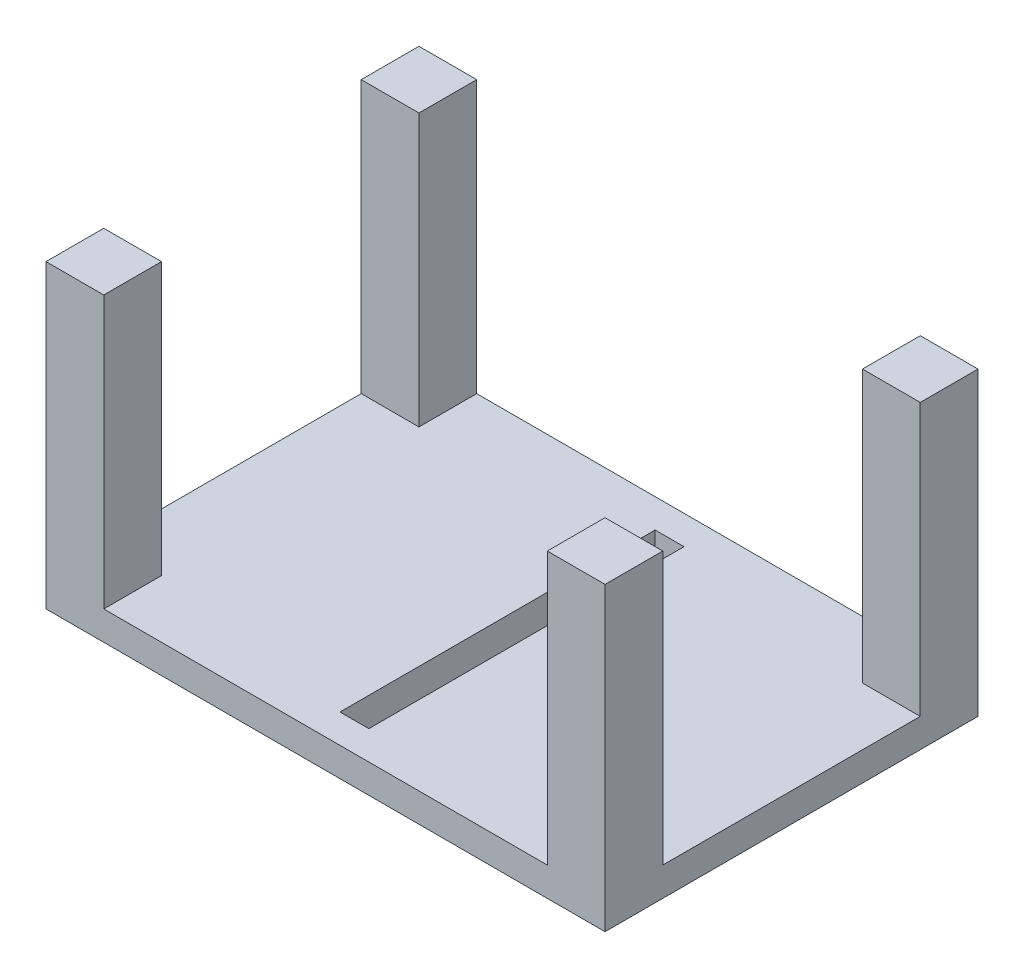
from build123d import *

# Parameters (mm, degrees)
SKETCH1_W           = 122.936
SKETCH1_H           = 82.0166
BOSS_EXTRUDE3_DEPTH = 6.35
SKETCH2_W           = 12.7
SKETCH2_H           = 12.7
BOSS_EXTRUDE4_DEPTH = 59.8
CUT_EXTRUDE1_REACH  = 101.176
SKETCH3_W           = 6.35
SKETCH3_H           = 69.3166


with BuildPart() as part:
    # Sketch1 → Boss-Extrude3 (new body)
    with BuildSketch(Plane(origin=(0, 0, 0), x_dir=(1, 0, 0), z_dir=(0, 1, 0))):
        Rectangle(SKETCH1_W, SKETCH1_H)
    extrude(amount=BOSS_EXTRUDE3_DEPTH)

    # Sketch2 → Boss-Extrude4 (add)
    with BuildSketch(Plane(origin=(0, 6.35, 0), x_dir=(1, 0, 0), z_dir=(0, 1, 0))):
        with Locations((-55.118, 34.6583)):
            Rectangle(SKETCH2_W, SKETCH2_H)
        with Locations((55.118, 34.6583)):
            Rectangle(SKETCH2_W, SKETCH2_H)
        with Locations((55.118, -34.6583)):
            Rectangle(SKETCH2_W, SKETCH2_H)
        with Locations((-55.118, -34.6583)):
            Rectangle(SKETCH2_W, SKETCH2_H)
    extrude(amount=BOSS_EXTRUDE4_DEPTH)

    # Sketch3 → Cut-Extrude1 (cut, up to next)
    with BuildSketch(Plane.XZ, mode=Mode.PRIVATE) as cut_extrude1_sk1:
        Rectangle(SKETCH3_W, SKETCH3_H)
    cut_extrude1_tool1 = extrude(cut_extrude1_sk1.sketch, amount=-CUT_EXTRUDE1_REACH, mode=Mode.PRIVATE) & part.part
    add(cut_extrude1_tool1.solids().sort_by_distance((0, 0, 0))[0], mode=Mode.SUBTRACT)


solid = part.part
